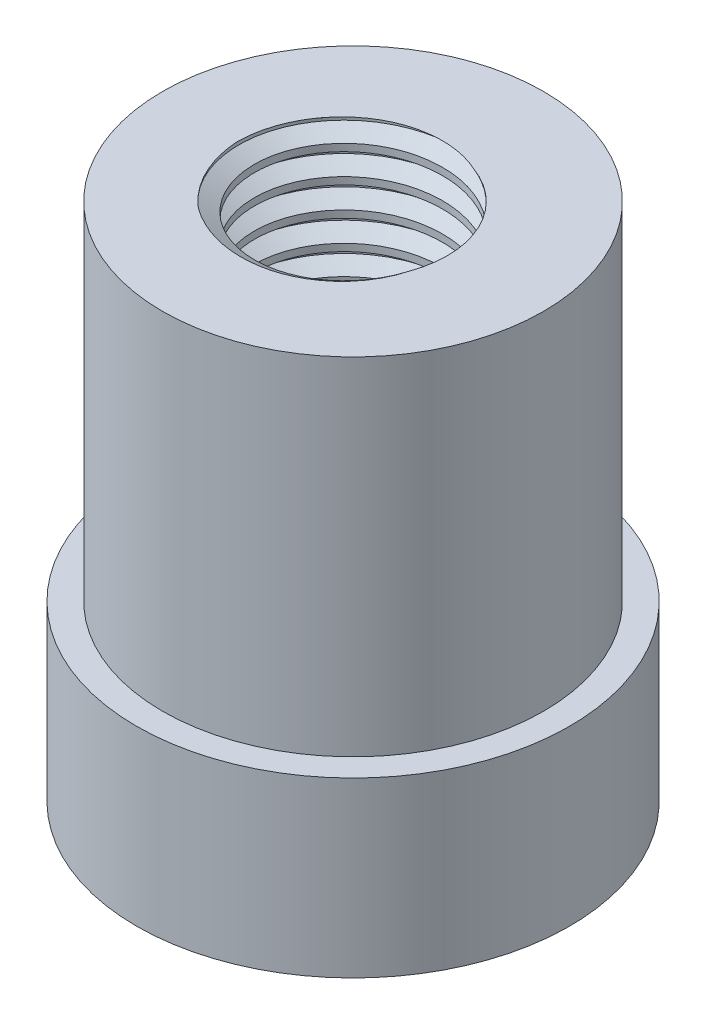
from build123d import *

# Parameters (mm, degrees)
SKETCH1_R           = 6.985
SKETCH1_R_2         = 3.4544
BOSS_EXTRUDE1_DEPTH = 19.05
SKETCH2_3_R         = 7.9375
SKETCH2_3_R_2       = 6.985
BOSS_EXTRUDE2_DEPTH = 6.35
THREAD1_PITCH       = 1.058333333


with BuildPart() as part:
    # Sketch1 → Boss-Extrude1 (new body)
    with BuildSketch(Plane(origin=(0, 0, 0), x_dir=(1, 0, 0), z_dir=(0, 1, 0))):
        with Locations(Location((0, 0, 0), (0, 0, 90))):
            Circle(SKETCH1_R)
        with Locations(Location((0, 0, 0), (0, 0, 90))):
            Circle(SKETCH1_R_2, mode=Mode.SUBTRACT)
    extrude(amount=BOSS_EXTRUDE1_DEPTH)

    # Sketch2<3> → Boss-Extrude2 (add)
    with BuildSketch(Plane(origin=(0, 0, 0), x_dir=(1, 0, 0), z_dir=(0, 1, 0))):
        with Locations(Location((0, 0, 0), (0, 0, 270))):
            Circle(SKETCH2_3_R)
        with Locations(Location((0, 0, 0), (0, 0, 90))):
            Circle(SKETCH2_3_R_2, mode=Mode.SUBTRACT)
    extrude(amount=BOSS_EXTRUDE2_DEPTH)

    # Thread1: the profile of Thread Profile1 profile screwed along a right-hand helix of 18.944882 turns, 8 arcs to a turn; built about Z, then put on its axis
    thread1_z = Axis((0, 0, 0), (0, 0, 1))
    thread1_corners = [(3.4541, 0, -0.000173205), (4.027239718, 0, 0.330729165), (4.027239718, 0, 0.463020832), (3.4541, 0, 0.793923202)]
    with BuildLine(mode=Mode.PRIVATE) as thread1_profile:
        Line(thread1_corners[0], thread1_corners[1])
        Line(thread1_corners[1], thread1_corners[2])
        Line(thread1_corners[2], thread1_corners[3])
        Line(thread1_corners[3], thread1_corners[0])
    thread1_cap = Face(thread1_profile.wire())
    thread1_turn_angles = [0, 22.5, 45, 67.5, 90, 112.5, 135, 157.5, 180, 202.5, 225, 247.5, 270, 292.5, 315, 337.5, 360]
    thread1_turn_weights = [1, 0.9238795325112867, 1, 0.9238795325112867, 1, 0.9238795325112867, 1, 0.9238795325112867, 1, 0.9238795325112867, 1, 0.9238795325112867, 1, 0.9238795325112867, 1, 0.9238795325112867, 1]
    thread1_turn_rails = [Edge.make_bspline([Vector(p[0], p[1], 0).rotate(thread1_z, thread1_turn_angles[k]) / thread1_turn_weights[k] + Vector(0, 0, p[2] + THREAD1_PITCH * thread1_turn_angles[k] / 360) for k in range(17)], [0, 0, 0, 1, 1, 2, 2, 3, 3, 4, 4, 5, 5, 6, 6, 7, 7, 8, 8, 8], 2, thread1_turn_weights) for p in thread1_corners]
    thread1_turn_sides = [Face.make_surface_from_curves(thread1_turn_rails[p[0]], thread1_turn_rails[p[1]]) for p in [(0, 1), (1, 2), (2, 3), (3, 0)]]
    thread1_last_angles = [6480, 6502.5, 6525, 6547.5, 6570, 6592.5, 6615, 6637.5, 6660, 6682.5, 6705, 6727.5, 6750, 6772.5, 6795, 6807.578740157, 6820.157480315]
    thread1_last_weights = [1, 0.9238795325112867, 1, 0.9238795325112867, 1, 0.9238795325112867, 1, 0.9238795325112867, 1, 0.9238795325112867, 1, 0.9238795325112867, 1, 0.9238795325112867, 1, 0.9759976377310857, 1]
    thread1_last_rails = [Edge.make_bspline([Vector(p[0], p[1], 0).rotate(thread1_z, thread1_last_angles[k]) / thread1_last_weights[k] + Vector(0, 0, p[2] + THREAD1_PITCH * thread1_last_angles[k] / 360) for k in range(17)], [0, 0, 0, 1, 1, 2, 2, 3, 3, 4, 4, 5, 5, 6, 6, 7, 7, 8, 8, 8], 2, thread1_last_weights) for p in thread1_corners]
    thread1_last_sides = [Face.make_surface_from_curves(thread1_last_rails[p[0]], thread1_last_rails[p[1]]) for p in [(0, 1), (1, 2), (2, 3), (3, 0)]]
    thread1 = Plane(origin=(0, -1, 0), x_dir=(1, 0, 0), z_dir=(0, 1, 0)) * Solid(Shell([*[p.moved(Location((0, 0, THREAD1_PITCH * i))) for i in range(18) for p in thread1_turn_sides], *thread1_last_sides, thread1_cap, thread1_cap.rotate(thread1_z, 6820.157480315).moved(Location((0, 0, THREAD1_PITCH * 6820.157480315 / 360)))]))
    add(thread1, mode=Mode.SUBTRACT)


solid = part.part
